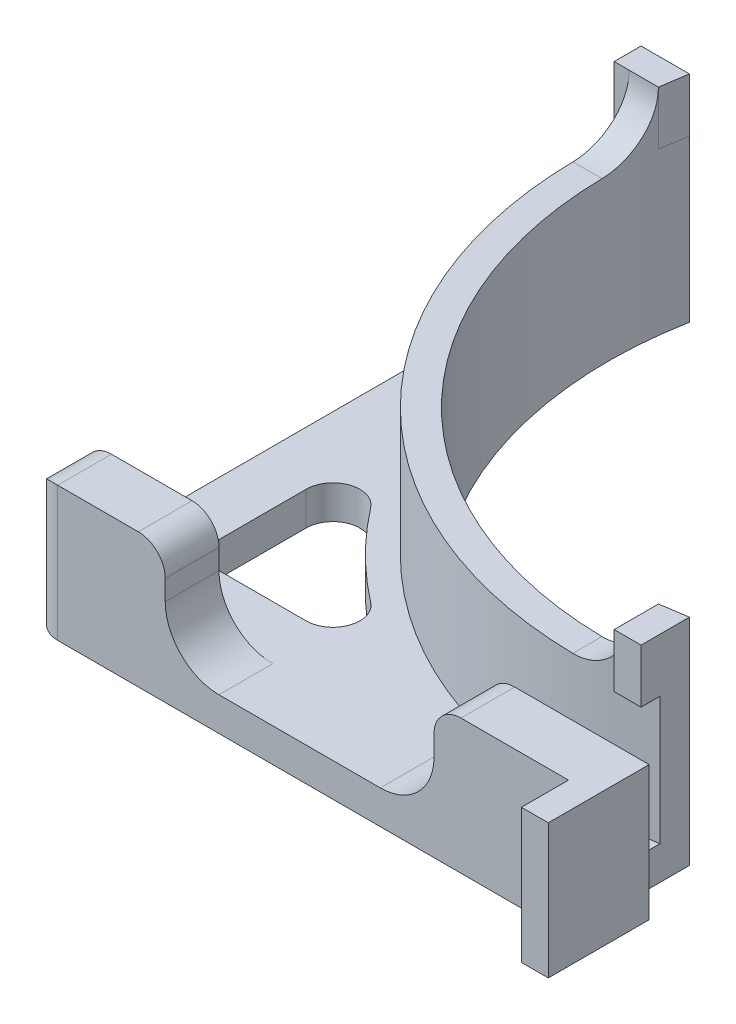
from build123d import *

# Parameters (mm, degrees)
BOSS_EXTRUDE1_DEPTH = 7.62
SKETCH2_R           = 33.285248113
SKETCH2_R_2         = 20.423872842
CUT_EXTRUDE1_DEPTH  = 6.0325
BOSS_EXTRUDE2_DEPTH = 2.54
BOSS_EXTRUDE3_DEPTH = 2.54
SKETCH5_W           = 4.7625
SKETCH5_H           = 6.35
BOSS_EXTRUDE4_DEPTH = 1.27
FILLET1_R           = 2.54
FILLET2_R           = 1.27


with BuildPart() as part:
    # Sketch1 → Boss-Extrude1 (new body)
    with BuildSketch(Plane(origin=(0, 0, 0), x_dir=(1, 0, 0), z_dir=(0, 1, 0))):
        with BuildLine():
            Line((0, 0), (25.4, 0))
            Line((25.4, 0), (25.4, 3.175))
            ThreePointArc((25.4, 3.175), (8.430498362, 8.430498362), (3.175, 25.4))
            Line((3.175, 25.4), (0, 25.4))
            Line((0, 25.4), (0, 0))
        make_face()
        with BuildLine():
            Line((2.54, 2.54), (2.54, 12.34659936))
            ThreePointArc((2.54, 12.34659936), (6.634447137, 6.634447137), (12.34659936, 2.54))
            Line((12.34659936, 2.54), (2.54, 2.54))
        make_face(mode=Mode.SUBTRACT)
    extrude(amount=BOSS_EXTRUDE1_DEPTH)

    # Sketch2 → Cut-Extrude1 (cut)
    with BuildSketch(Plane(origin=(0, 7.62, 0), x_dir=(1, 0, 0), z_dir=(0, 1, 0))):
        with Locations((21.900882543, 21.900882543)):
            Circle(SKETCH2_R)
        with Locations((21.900882543, 21.900882543)):
            Circle(SKETCH2_R_2, mode=Mode.SUBTRACT)
    extrude(amount=-CUT_EXTRUDE1_DEPTH, mode=Mode.SUBTRACT)

    # Sketch3 → Boss-Extrude2 (add)
    with BuildSketch(Plane.XY):
        Polygon((0, 0), (0, 6.35), (6.35, 6.35), (6.35, 1.5875), (19.05, 1.5875), (19.05, 6.35), (25.4, 6.35), (25.4, 0), align=None)
    extrude(amount=BOSS_EXTRUDE2_DEPTH)

    # Sketch4 → Boss-Extrude3 (add)
    with BuildSketch(Plane(origin=(0, 7.62, 0), x_dir=(1, 0, 0), z_dir=(0, 1, 0))):
        Polygon((3.175, 25.4), (0.889492523, 25.4), (0.889492523, 24.13), (2.981751079, 24.13), align=None)
        Polygon((25.4, 3.175), (25.4, 0.889492523), (24.13, 0.889492523), (24.13, 2.981751079), align=None)
    extrude(amount=BOSS_EXTRUDE3_DEPTH)

    # Sketch5 → Boss-Extrude4 (add)
    with BuildSketch(Plane(origin=(25.4, 0, 0), x_dir=(0, 0, -1), z_dir=(1, 0, 0))):
        with Locations((-2.38125, 3.175)):
            Rectangle(SKETCH5_W, SKETCH5_H)
    extrude(amount=BOSS_EXTRUDE4_DEPTH)

    # Fillet1
    # the kernel refuses this fillet: 2.54 mm, written as the material it adds along each edge
    with BuildSketch(Plane(origin=(19.05, 1.5875, 0), x_dir=(0, 1, 0), z_dir=(0, 0, 1))) as fillet1_piece_1:
        with BuildLine():
            CenterArc((FILLET1_R, FILLET1_R), FILLET1_R, 180, 90)
            Line((0, FILLET1_R), (0, 0))
            Line((0, 0), (FILLET1_R, 0))
        make_face()
    extrude(amount=2.54)
    with BuildSketch(Plane(origin=(6.35, 1.5875, 0), x_dir=(0, 1, 0), z_dir=(0, 0, 1))) as fillet1_piece_2:
        with BuildLine():
            CenterArc((FILLET1_R, -FILLET1_R), FILLET1_R, 90, 90)
            Line((0, -FILLET1_R), (0, 0))
            Line((0, 0), (FILLET1_R, 0))
        make_face()
    extrude(amount=2.54)
    with BuildSketch(Plane(origin=(-4.750979865, 7.62, -24.13), x_dir=(0, 0, 1), z_dir=(1, 0, 0))) as fillet1_piece_3_section:
        with BuildLine():
            CenterArc((FILLET1_R, -FILLET1_R), FILLET1_R, 90, 90)
            Line((0, -FILLET1_R), (0, 0))
            Line((0, 0), (FILLET1_R, 0))
        make_face()
    fillet1_piece_3 = extrude(amount=14.082730944, mode=Mode.PRIVATE)
    fillet1_piece_3 = fillet1_piece_3 & Plane(origin=(21.900882543, 8.195059905, -21.900882543), x_dir=(1, 0, 0), z_dir=(0, 1, 0)) * Cylinder(20.423872842, 39, mode=Mode.PRIVATE)
    fillet1_piece_3 = fillet1_piece_3 - Plane(origin=(21.900882543, 8.195059905, -21.900882543), x_dir=(0.18368070639060669, 0, 0.98298596027606), z_dir=(0, -1, 0)) * Cylinder(19.05, 39, mode=Mode.PRIVATE)
    add(fillet1_piece_3)
    with BuildSketch(Plane(origin=(24.13, 7.62, 4.750979865), x_dir=(0, 1, 0), z_dir=(0, 0, -1))) as fillet1_piece_4_section:
        with BuildLine():
            CenterArc((FILLET1_R, -FILLET1_R), FILLET1_R, 90, 90)
            Line((0, -FILLET1_R), (0, 0))
            Line((0, 0), (FILLET1_R, 0))
        make_face()
    fillet1_piece_4 = extrude(amount=14.082730944, mode=Mode.PRIVATE)
    fillet1_piece_4 = fillet1_piece_4 & Plane(origin=(21.900882543, 8.195056038, -21.900882543), x_dir=(1, 0, 0), z_dir=(0, 1, 0)) * Cylinder(20.423872842, 39, mode=Mode.PRIVATE)
    fillet1_piece_4 = fillet1_piece_4 - Plane(origin=(21.900882543, 8.195056038, -21.900882543), x_dir=(0.18368070639060669, 0, 0.98298596027606), z_dir=(0, -1, 0)) * Cylinder(19.05, 39, mode=Mode.PRIVATE)
    add(fillet1_piece_4)

    # Fillet2
    fillet2_edges = [part.edges().sort_by_distance(p)[0] for p in [
        (2.54, 0.79375, -12.34659936),
        (2.54, 0.79375, -2.54),
        (12.34659936, 0.79375, -2.54),
        (0, 0.79375, -25.4),
        (19.05, 6.35, 1.27),
        (6.35, 6.35, 1.27),
        (0, 6.35, 1.27),
        (0, 3.175, 2.54),
    ]]
    fillet(fillet2_edges, radius=FILLET2_R)


solid = part.part
